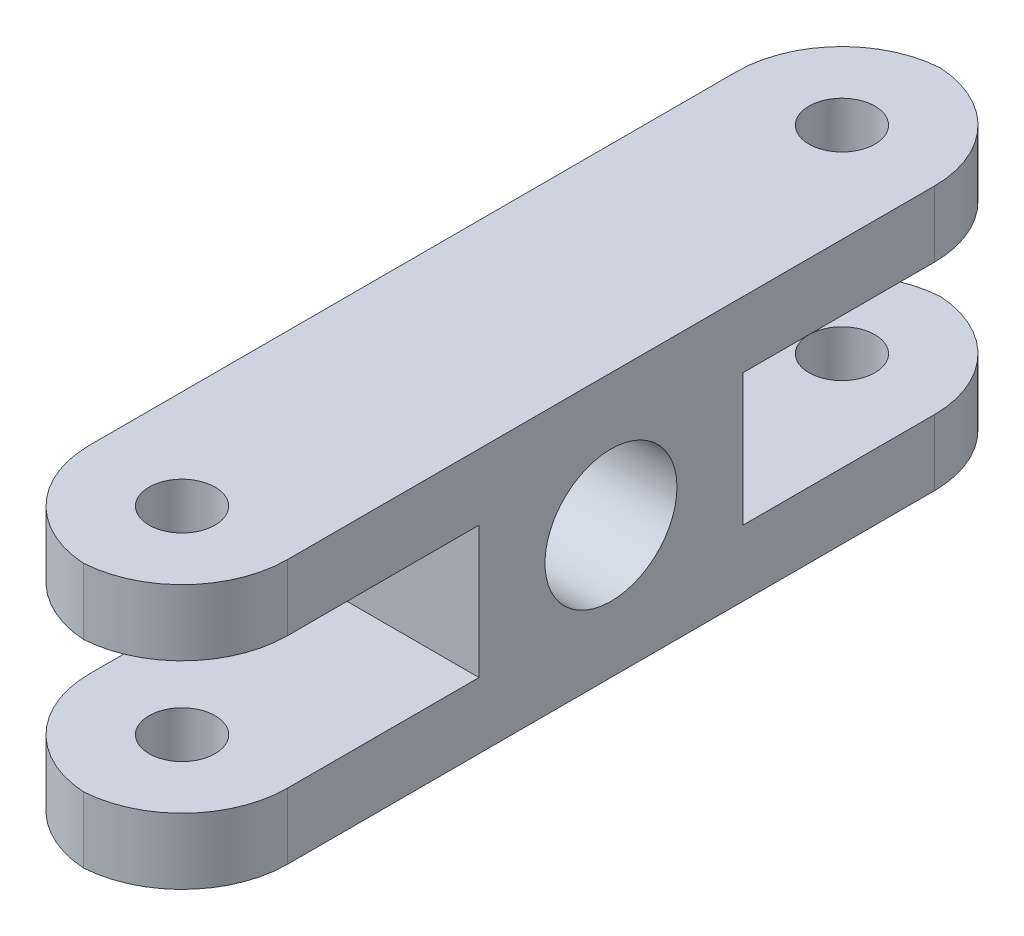
from build123d import *

# Parameters (mm, degrees)
SKETCH1_W           = 15
SKETCH1_H           = 65
BOSS_EXTRUDE1_DEPTH = 20
SKETCH2_R           = 2.5
CUT_EXTRUDE1_DEPTH  = 20
SKETCH6_R           = 5
CUT_EXTRUDE3_DEPTH  = 15
SKETCH7_W           = 22.5
SKETCH7_H           = 5
SKETCH7_H_2         = 10
CUT_EXTRUDE4_DEPTH  = 15
FILLET3_R           = 8


with BuildPart() as part:
    # Sketch1 → Boss-Extrude1 (new body)
    with BuildSketch(Plane(origin=(0, 0, 0), x_dir=(1, 0, 0), z_dir=(0, 1, 0))):
        Rectangle(SKETCH1_W, SKETCH1_H)
    extrude(amount=BOSS_EXTRUDE1_DEPTH)

    # Sketch2 → Cut-Extrude1 (cut)
    with BuildSketch(Plane(origin=(0, 20, 0), x_dir=(1, 0, 0), z_dir=(0, 1, 0))):
        with Locations(Location((0, 25, 0), (0, 0, 270))):
            Circle(SKETCH2_R)
        with Locations(Location((0, -25, 0), (0, 0, 90))):
            Circle(SKETCH2_R)
    extrude(amount=-CUT_EXTRUDE1_DEPTH, mode=Mode.SUBTRACT)

    # Sketch6 → Cut-Extrude3 (cut)
    with BuildSketch(Plane(origin=(7.5, 0, 0), x_dir=(0, 0, -1), z_dir=(1, 0, 0))):
        with Locations((0, 10)):
            Circle(SKETCH6_R)
    extrude(amount=-CUT_EXTRUDE3_DEPTH, mode=Mode.SUBTRACT)

    # Sketch7 → Cut-Extrude4 (cut)
    with BuildSketch(Plane(origin=(7.5, 0, 0), x_dir=(0, 0, -1), z_dir=(1, 0, 0))):
        with Locations((-21.25, 12.5)):
            Rectangle(SKETCH7_W, SKETCH7_H)
        with Locations((-21.25, 7.5)):
            Rectangle(SKETCH7_W, SKETCH7_H)
        with Locations((21.25, 10)):
            Rectangle(SKETCH7_W, SKETCH7_H_2)
    extrude(amount=-CUT_EXTRUDE4_DEPTH, mode=Mode.SUBTRACT)

    # Fillet3
    # the kernel refuses this fillet: 8 mm, written as the material it takes off along each edge
    with BuildSketch(Plane(origin=(-7.5, -20, 32.5), x_dir=(1, 0, 0), z_dir=(0, 1, 0)), Plane(origin=(-7.5, -20, -32.5), x_dir=(0, 0, 1), z_dir=(0, 1, 0)), Plane(origin=(-7.5, -5, -32.5), x_dir=(0, 0, 1), z_dir=(0, 1, 0)), Plane(origin=(7.5, -5, 32.5), x_dir=(0, 0, -1), z_dir=(0, 1, 0))) as fillet3_piece_1:
        with BuildLine():
            CenterArc((FILLET3_R, FILLET3_R), FILLET3_R, 180, 90)
            Line((0, FILLET3_R), (0, 0))
            Line((0, 0), (FILLET3_R, 0))
        make_face()
    extrude(amount=45, mode=Mode.SUBTRACT)
    with BuildSketch(Plane(origin=(7.5, -20, 32.5), x_dir=(-1, 0, 0), z_dir=(0, 1, 0)), Plane(origin=(7.5, -20, -32.5), x_dir=(0, 0, 1), z_dir=(0, 1, 0)), Plane(origin=(7.5, -5, -32.5), x_dir=(0, 0, 1), z_dir=(0, 1, 0)), Plane(origin=(-7.5, -5, 32.5), x_dir=(0, 0, -1), z_dir=(0, 1, 0))) as fillet3_piece_2:
        with BuildLine():
            CenterArc((FILLET3_R, -FILLET3_R), FILLET3_R, 90, 90)
            Line((0, -FILLET3_R), (0, 0))
            Line((0, 0), (FILLET3_R, 0))
        make_face()
    extrude(amount=45, mode=Mode.SUBTRACT)


solid = part.part
